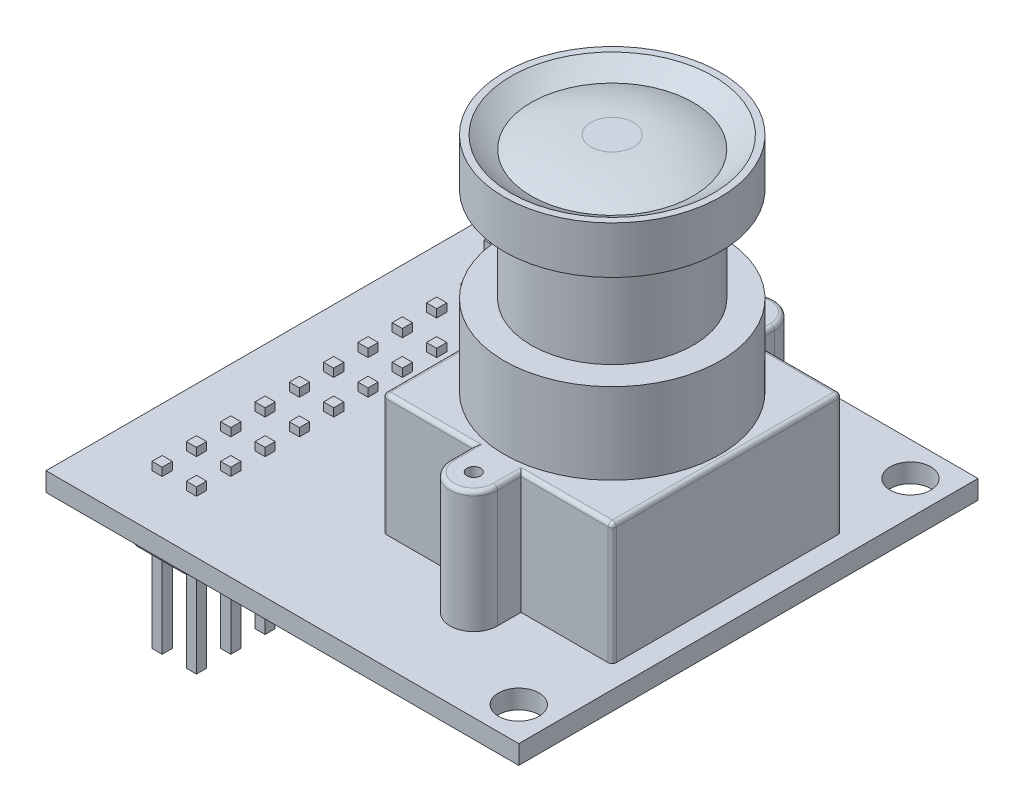
from build123d import *

# Parameters (mm, degrees)
SKETCH1_W                = 35
SKETCH1_H                = 34
SKETCH1_R                = 1.5
BOSS_EXTRUDE1_DEPTH      = 1.4
SKETCH2_R                = 0.5
BOSS_EXTRUDE2_DEPTH      = 9
BOSS_EXTRUDE3_DEPTH      = 6
SKETCH4_R                = 6
BOSS_EXTRUDE4_DEPTH      = 7
SKETCH5_R                = 8
BOSS_EXTRUDE5_DEPTH      = 3.5
SKETCH6_R                = 7.5
CUT_EXTRUDE1_DEPTH       = 2
FILLET1_R                = 10
SKETCH7_R                = 6
BOSS_EXTRUDE6_DEPTH      = 2
FILLET2_R                = 11
FILLET3_R                = 0.3
SKETCH8_R                = 0.5
CUT_EXTRUDE2_DEPTH       = 0.5
BOSS_EXTRUDE7_DEPTH      = 10
BOSS_EXTRUDE7_DEPTH_BACK = 2
SKETCH9_W                = 0.75
SKETCH9_H                = 0.75
SKETCH10_W               = 5.29
SKETCH10_H               = 28.15
BOSS_EXTRUDE8_DEPTH      = 3
FILLET4_R                = 1


with BuildPart() as part:
    # Sketch1 → Boss-Extrude1 (new body)
    with BuildSketch(Plane(origin=(0, 0, 0), x_dir=(1, 0, 0), z_dir=(0, 1, 0))):
        with Locations((-1.733490566, -8.5)):
            Rectangle(SKETCH1_W, SKETCH1_H)
        with Locations(Location((13.266509434, 6, 0), (0, 0, 270))):
            Circle(SKETCH1_R, mode=Mode.SUBTRACT)
        with Locations(Location((13.266509434, -23, 0), (0, 0, 270))):
            Circle(SKETCH1_R, mode=Mode.SUBTRACT)
    extrude(amount=BOSS_EXTRUDE1_DEPTH)

    # Sketch2 → Boss-Extrude2 (add)
    with BuildSketch(Plane(origin=(0, 1.4, 0), x_dir=(1, 0, 0), z_dir=(0, 1, 0))):
        with BuildLine():
            Line((-2.813490566, 0), (3.936509434, 0))
            Line((3.936509434, 0), (3.936509434, 1.75))
            ThreePointArc((3.936509434, 1.75), (5.686509434, 3.5), (7.436509434, 1.75))
            Line((7.436509434, 1.75), (7.436509434, 0))
            Line((7.436509434, 0), (14.186509434, 0))
            Line((14.186509434, 0), (14.186509434, -17))
            Line((14.186509434, -17), (7.436509434, -17))
            Line((7.436509434, -17), (7.436509434, -18.75))
            ThreePointArc((7.436509434, -18.75), (5.686509434, -20.5), (3.936509434, -18.75))
            Line((3.936509434, -18.75), (3.936509434, -17))
            Line((3.936509434, -17), (-2.813490566, -17))
            Line((-2.813490566, -17), (-2.813490566, 0))
        make_face()
        with Locations(Location((5.686509434, 1.75, 0), (0, 0, 270))):
            Circle(SKETCH2_R, mode=Mode.SUBTRACT)
        with Locations(Location((5.686509434, -18.75, 0), (0, 0, 270))):
            Circle(SKETCH2_R, mode=Mode.SUBTRACT)
    extrude(amount=BOSS_EXTRUDE2_DEPTH)

    # Sketch3 → Boss-Extrude3 (add)
    with BuildSketch(Plane(origin=(0, 10.4, 0), x_dir=(1, 0, 0), z_dir=(0, 1, 0))):
        with BuildLine():
            Line((-2.813490566, -9.5), (-2.250744499, -9.5))
            ThreePointArc((-2.250744499, -9.5), (13.686509434, -8.5), (-2.250744499, -7.5))
            Line((-2.250744499, -7.5), (-2.813490566, -7.5))
            Line((-2.813490566, -7.5), (-2.813490566, -9.5))
        make_face()
    extrude(amount=BOSS_EXTRUDE3_DEPTH)

    # Sketch4 → Boss-Extrude4 (add)
    with BuildSketch(Plane(origin=(0, 16.4, 0), x_dir=(1, 0, 0), z_dir=(0, 1, 0))):
        with Locations(Location((5.686509434, -8.5, 0), (0, 0, 270))):
            Circle(SKETCH4_R)
    extrude(amount=BOSS_EXTRUDE4_DEPTH)

    # Sketch5 → Boss-Extrude5 (add)
    with BuildSketch(Plane(origin=(0, 23.4, 0), x_dir=(1, 0, 0), z_dir=(0, 1, 0))):
        with Locations(Location((5.686509434, -8.5, 0), (0, 0, 270))):
            Circle(SKETCH5_R)
    extrude(amount=BOSS_EXTRUDE5_DEPTH)

    # Sketch6 → Cut-Extrude1 (cut)
    with BuildSketch(Plane(origin=(0, 26.9, 0), x_dir=(1, 0, 0), z_dir=(0, 1, 0))):
        with Locations(Location((5.686509434, -8.5, 0), (0, 0, 270))):
            Circle(SKETCH6_R)
    extrude(amount=-CUT_EXTRUDE1_DEPTH, mode=Mode.SUBTRACT)

    # Fillet1
    # the kernel refuses this fillet: 10 mm, written as the material it adds along each edge
    with BuildSketch(Plane(origin=(5.686509434, 24.9, 8.5), x_dir=(0, 0, 1), z_dir=(-1, 0, 0))) as fillet1_piece_1:
        with BuildLine():
            CenterArc((1.5, 10), FILLET1_R, 270, 36.869897646)
            Line((1.5, 0), (1.5, -0.2))
            Line((1.5, -0.2), (7.5, -0.2))
            Line((7.5, -0.2), (7.7, 0))
            ThreePointArc((7.7, 0), (7.7, 1), (7.62, 1.84))
            Line((7.62, 1.84), (7.5, 2))
        make_face()
    revolve(axis=Axis((5.686509434, 24.9, 8.5), (0, 1, 0)))

    # Sketch7 → Boss-Extrude6 (add)
    with BuildSketch(Plane(origin=(0, 24.9, 0), x_dir=(1, 0, 0), z_dir=(0, 1, 0))):
        with Locations(Location((5.686509434, -8.5, 0), (0, 0, 270))):
            Circle(SKETCH7_R)
    extrude(amount=BOSS_EXTRUDE6_DEPTH)

    # Fillet2
    # the kernel refuses this fillet: 11 mm, written as the material it takes off along each edge
    with BuildSketch(Plane(origin=(5.686509434, 26.9, 8.5), x_dir=(0, 0, 1), z_dir=(-1, 0, 0))) as fillet2_piece_1:
        with BuildLine():
            CenterArc((1.572715179, -11), FILLET2_R, 66.266665489, 23.733334511)
            Line((1.572715179, 0), (1.572715179, 0.22))
            Line((1.572715179, 0.22), (6, 0.22))
            Line((6, 0.22), (6.22, 0))
            ThreePointArc((6.22, 0), (6.22, -0.465142775), (6.088545696, -0.728891261))
            Line((6.088545696, -0.728891261), (6, -0.93028555))
        make_face()
    revolve(axis=Axis((5.686509434, 26.9, 8.5), (0, 1, 0)), mode=Mode.SUBTRACT)

    # Fillet3
    fillet3_edges = [part.edges().sort_by_distance(p)[0] for p in [
        (-2.813490566, 10.4, 3.75),
        (0.561509434, 10.4, 17),
        (3.936509434, 10.4, 17.875),
        (5.686509434, 10.4, 20.5),
        (7.436509434, 10.4, 17.875),
        (10.811509434, 10.4, 17),
        (14.186509434, 10.4, 8.5),
        (10.811509434, 10.4, 0),
        (7.436509434, 10.4, -0.875),
        (5.686509434, 10.4, -3.5),
        (3.936509434, 10.4, -0.875),
        (0.561509434, 10.4, 0),
        (-2.813490566, 5.9, 0),
        (-2.813490566, 5.9, 17),
        (14.186509434, 5.9, 17),
        (14.186509434, 5.9, 0),
        (-2.813490566, 10.4, 13.25),
    ]]
    fillet(fillet3_edges, radius=FILLET3_R)

    # Sketch8 → Cut-Extrude2 (cut)
    with BuildSketch(Plane.ZY.offset(2.813490566)):
        with Locations((8.5, 13.9)):
            Circle(SKETCH8_R)
    extrude(amount=-CUT_EXTRUDE2_DEPTH, mode=Mode.SUBTRACT)

    # Sketch9 → Boss-Extrude7 (add, two sides: drawn at the far end of the back side and taken through both)
    with BuildSketch(Plane.XZ.offset(-BOSS_EXTRUDE7_DEPTH_BACK)):
        with Locations((-12.393490566, 21.2)):
            Rectangle(SKETCH9_W, SKETCH9_H)
        with Locations((-14.933490566, 21.2)):
            Rectangle(SKETCH9_W, SKETCH9_H)
        with Locations((-12.393490566, 18.66)):
            Rectangle(SKETCH9_W, SKETCH9_H)
        with Locations((-12.393490566, 16.12)):
            Rectangle(SKETCH9_W, SKETCH9_H)
        with Locations((-12.393490566, 13.58)):
            Rectangle(SKETCH9_W, SKETCH9_H)
        with Locations((-12.393490566, 11.04)):
            Rectangle(SKETCH9_W, SKETCH9_H)
        with Locations((-12.393490566, 8.5)):
            Rectangle(SKETCH9_W, SKETCH9_H)
        with Locations((-12.393490566, 5.96)):
            Rectangle(SKETCH9_W, SKETCH9_H)
        with Locations((-12.393490566, 3.42)):
            Rectangle(SKETCH9_W, SKETCH9_H)
        with Locations((-12.393490566, 0.88)):
            Rectangle(SKETCH9_W, SKETCH9_H)
        with Locations((-12.393490566, -1.66)):
            Rectangle(SKETCH9_W, SKETCH9_H)
        with Locations((-12.393490566, -4.2)):
            Rectangle(SKETCH9_W, SKETCH9_H)
        with Locations((-14.933490566, 18.66)):
            Rectangle(SKETCH9_W, SKETCH9_H)
        with Locations((-14.933490566, 16.12)):
            Rectangle(SKETCH9_W, SKETCH9_H)
        with Locations((-14.933490566, 13.58)):
            Rectangle(SKETCH9_W, SKETCH9_H)
        with Locations((-14.933490566, 11.04)):
            Rectangle(SKETCH9_W, SKETCH9_H)
        with Locations((-14.933490566, 8.5)):
            Rectangle(SKETCH9_W, SKETCH9_H)
        with Locations((-14.933490566, 5.96)):
            Rectangle(SKETCH9_W, SKETCH9_H)
        with Locations((-14.933490566, 3.42)):
            Rectangle(SKETCH9_W, SKETCH9_H)
        with Locations((-14.933490566, 0.88)):
            Rectangle(SKETCH9_W, SKETCH9_H)
        with Locations((-14.933490566, -1.66)):
            Rectangle(SKETCH9_W, SKETCH9_H)
        with Locations((-14.933490566, -4.2)):
            Rectangle(SKETCH9_W, SKETCH9_H)
    extrude(amount=BOSS_EXTRUDE7_DEPTH + BOSS_EXTRUDE7_DEPTH_BACK)

    # Sketch10 → Boss-Extrude8 (add)
    with BuildSketch(Plane.XZ):
        with Locations((-13.663490566, 8.5)):
            Rectangle(SKETCH10_W, SKETCH10_H)
    extrude(amount=BOSS_EXTRUDE8_DEPTH)

    # Fillet4
    fillet4_edges = [part.edges().sort_by_distance(p)[0] for p in [
        (-16.308490566, -1.5, 22.575),
        (-16.308490566, -1.5, -5.575),
        (-11.018490566, -1.5, -5.575),
        (-11.018490566, -1.5, 22.575),
    ]]
    fillet(fillet4_edges, radius=FILLET4_R)


solid = part.part
